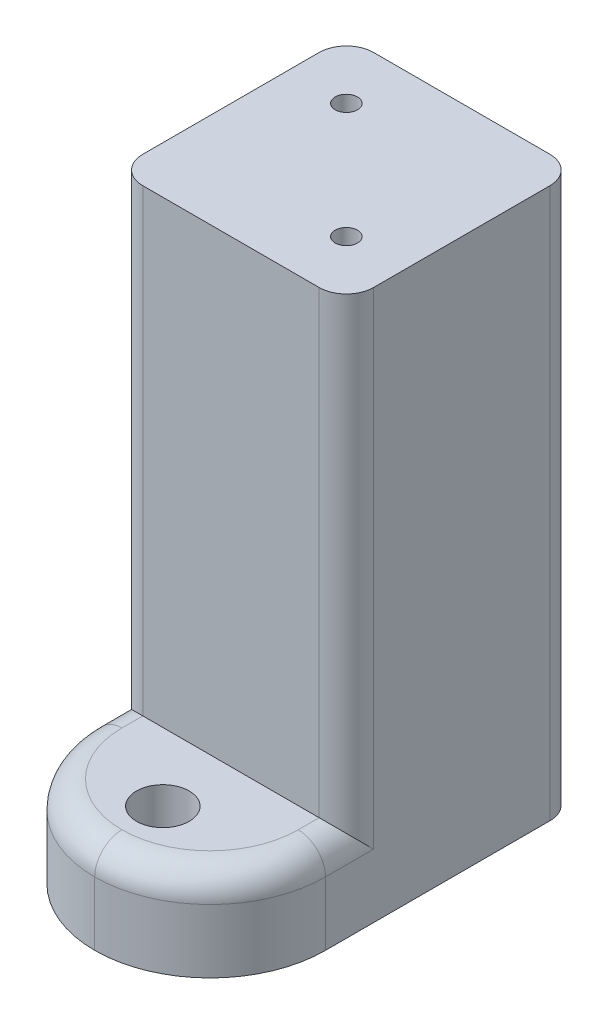
from build123d import *

# Parameters (mm, degrees)
SKETCH1_W           = 25.4
SKETCH1_H           = 40.4
BOSS_EXTRUDE1_DEPTH = 10
SKETCH2_W           = 25.4
SKETCH2_H           = 25.4
BOSS_EXTRUDE2_DEPTH = 50.54
SKETCH3_R           = 1.2303
CUT_EXTRUDE1_DEPTH  = 20
SKETCH4_R           = 2.9
CUT_EXTRUDE2_DEPTH  = 66.937406682
FILLET1_R           = 3
FILLET2_R           = 12.7


with BuildPart() as part:
    # Sketch1 → Boss-Extrude1 (new body)
    with BuildSketch(Plane(origin=(0, 0, 0), x_dir=(1, 0, 0), z_dir=(0, 1, 0))):
        with Locations((0, 20.2)):
            Rectangle(SKETCH1_W, SKETCH1_H)
    extrude(amount=BOSS_EXTRUDE1_DEPTH)

    # Sketch2 → Boss-Extrude2 (add)
    with BuildSketch(Plane(origin=(0, 10, 0), x_dir=(1, 0, 0), z_dir=(0, 1, 0))):
        with Locations((0, 27.7)):
            Rectangle(SKETCH2_W, SKETCH2_H)
    extrude(amount=BOSS_EXTRUDE2_DEPTH)

    # Sketch3 → Cut-Extrude1 (cut)
    with BuildSketch(Plane(origin=(0, 60.54, 0), x_dir=(1, 0, 0), z_dir=(0, 1, 0))):
        with Locations(Location((-6.35, 34.05, 0), (0, 0, 270))):
            Circle(SKETCH3_R)
        with Locations(Location((6.35, 21.35, 0), (0, 0, 270))):
            Circle(SKETCH3_R)
    extrude(amount=-CUT_EXTRUDE1_DEPTH, mode=Mode.SUBTRACT)

    # Sketch4 → Cut-Extrude2 (cut, through all)
    with BuildSketch(Plane(origin=(0, 10, 0), x_dir=(1, 0, 0), z_dir=(0, 1, 0))):
        with Locations(Location((0, 7.5, 0), (0, 0, 270))):
            Circle(SKETCH4_R)
    extrude(amount=-CUT_EXTRUDE2_DEPTH, mode=Mode.SUBTRACT)

    # Fillet1
    fillet1_edges = [part.edges().sort_by_distance(p)[0] for p in [
        (12.7, 10, -7.5),
        (-12.7, 10, -7.5),
        (-12.7, 35.27, -15),
        (12.7, 35.27, -15),
        (0, 10, 0),
        (-12.7, 30.27, -40.4),
        (12.7, 30.27, -40.4),
    ]]
    fillet(fillet1_edges, radius=FILLET1_R)

    # Fillet2
    # the kernel refuses this fillet: 12.7 mm, written as the material it takes off along each edge
    with BuildSketch(Plane(origin=(0, 10, -12.7), x_dir=(-1, 0, 0), z_dir=(0, 0, -1))) as fillet2_piece_1:
        with BuildLine():
            CenterArc((9.7, -3), 3, 0, 90)
            Line((12.7, -3), (12.7, 0))
            Line((12.7, 0), (9.7, 0))
        make_face()
    revolve(axis=Axis((0, 10, -12.7), (0, 1, 0)), revolution_arc=90, mode=Mode.SUBTRACT)
    with BuildSketch(Plane(origin=(0, 10, -12.7), x_dir=(0, 0, 1), z_dir=(-1, 0, 0))) as fillet2_piece_2:
        with BuildLine():
            CenterArc((9.7, -3), 3, 0, 90)
            Line((12.7, -3), (12.7, 0))
            Line((12.7, 0), (9.7, 0))
        make_face()
    revolve(axis=Axis((0, 10, -12.7), (0, 1, 0)), revolution_arc=90, mode=Mode.SUBTRACT)
    with BuildSketch(Plane(origin=(12.7, -31.75, 0), x_dir=(0, 0, -1), z_dir=(0, 1, 0))) as fillet2_piece_3:
        with BuildLine():
            CenterArc((FILLET2_R, FILLET2_R), FILLET2_R, 180, 90)
            Line((0, FILLET2_R), (0, 0))
            Line((0, 0), (FILLET2_R, 0))
        make_face()
    extrude(amount=41.75, mode=Mode.SUBTRACT)
    with BuildSketch(Plane(origin=(-12.7, -31.75, 0), x_dir=(0, 0, -1), z_dir=(0, 1, 0))) as fillet2_piece_4:
        with BuildLine():
            CenterArc((FILLET2_R, -FILLET2_R), FILLET2_R, 90, 90)
            Line((0, -FILLET2_R), (0, 0))
            Line((0, 0), (FILLET2_R, 0))
        make_face()
    extrude(amount=41.75, mode=Mode.SUBTRACT)


solid = part.part
